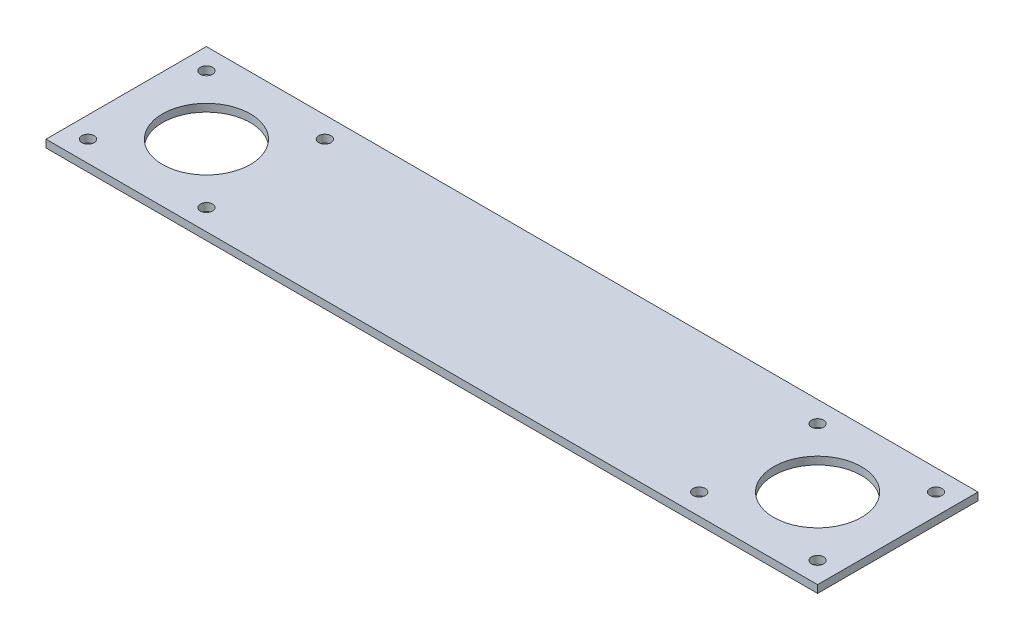
from build123d import *

# Parameters (mm, degrees)
SKETCH1_W           = 202
SKETCH1_H           = 42
SKETCH1_R           = 1.6
SKETCH1_R_2         = 11.5
BOSS_EXTRUDE1_DEPTH = 2


with BuildPart() as part:
    # Sketch1 → Boss-Extrude1 (new body)
    with BuildSketch(Plane(origin=(0, 0, 0), x_dir=(1, 0, 0), z_dir=(0, 1, 0))):
        Rectangle(SKETCH1_W, SKETCH1_H)
        with Locations((-95.5, -15.5)):
            Circle(SKETCH1_R, mode=Mode.SUBTRACT)
        with Locations((-64.5, -15.5)):
            Circle(SKETCH1_R, mode=Mode.SUBTRACT)
        with Locations((64.5, -15.5)):
            Circle(SKETCH1_R, mode=Mode.SUBTRACT)
        with Locations((95.5, -15.5)):
            Circle(SKETCH1_R, mode=Mode.SUBTRACT)
        with Locations((-80, 0)):
            Circle(SKETCH1_R_2, mode=Mode.SUBTRACT)
        with Locations((-95.5, 15.5)):
            Circle(SKETCH1_R, mode=Mode.SUBTRACT)
        with Locations((-64.5, 15.5)):
            Circle(SKETCH1_R, mode=Mode.SUBTRACT)
        with Locations((80, 0)):
            Circle(SKETCH1_R_2, mode=Mode.SUBTRACT)
        with Locations((64.5, 15.5)):
            Circle(SKETCH1_R, mode=Mode.SUBTRACT)
        with Locations((95.5, 15.5)):
            Circle(SKETCH1_R, mode=Mode.SUBTRACT)
    extrude(amount=BOSS_EXTRUDE1_DEPTH)


solid = part.part
